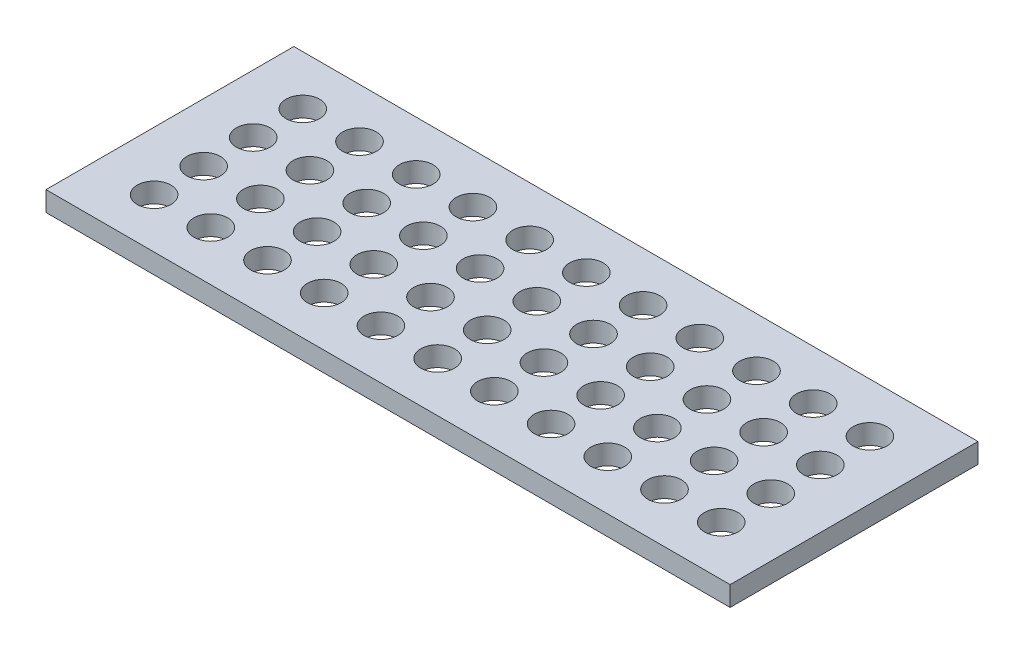
from build123d import *

# Parameters (mm, degrees)
SKETCH1_W             = 345
SKETCH1_H             = 125
SKETCH1_R             = 8.5
BOSS_EXTRUDE1_DEPTH   = 10
SKETCH1_3_R           = 8.5
CUT_EXTRUDE1_DEPTH    = 184.74574825
CRVPATTERN1_OUTLINE_R = 8.5
CRVPATTERN1_DEPTH     = 10


# Read off the part's stored shape, not the designer's step: CrvPattern1
with BuildPart() as part:
    # Sketch1 → Boss-Extrude1 (new body)
    # profile 1 of 2: a face of its own
    with BuildSketch(Plane(origin=(0, 0, 0), x_dir=(1, 0, 0), z_dir=(0, 1, 0))):
        Rectangle(SKETCH1_W, SKETCH1_H)
        with Locations((-143, 37.5)):
            Circle(SKETCH1_R, mode=Mode.SUBTRACT)
    # profile 2 of 2: a face of its own
    with BuildSketch(Plane(origin=(0, 0, 0), x_dir=(1, 0, 0), z_dir=(0, 1, 0))):
        with Locations((-143, 37.5)):
            Circle(SKETCH1_R)
    extrude(amount=BOSS_EXTRUDE1_DEPTH)

    # Sketch1<3> → Cut-Extrude1 (cut, through all)
    with BuildSketch(Plane(origin=(0, 0, 0), x_dir=(1, 0, 0), z_dir=(0, 1, 0))):
        with Locations(Location((-143, 37.5, 0), (0, 0, 270))):
            Circle(SKETCH1_3_R)
    extrude(amount=CUT_EXTRUDE1_DEPTH, mode=Mode.SUBTRACT)

    # CrvPattern1 outline → CrvPattern1 (cut)
    with BuildSketch(Plane(origin=(0, 0, 0), x_dir=(1, 0, 0), z_dir=(0, 1, 0))):
        with Locations((-143, 12.5)):
            Circle(CRVPATTERN1_OUTLINE_R)
        with Locations((143, 12.5)):
            Circle(CRVPATTERN1_OUTLINE_R)
        with Locations((143, 37.5)):
            Circle(CRVPATTERN1_OUTLINE_R)
        with Locations((114.4, -37.5)):
            Circle(CRVPATTERN1_OUTLINE_R)
        with Locations((114.4, -12.5)):
            Circle(CRVPATTERN1_OUTLINE_R)
        with Locations((114.4, 12.5)):
            Circle(CRVPATTERN1_OUTLINE_R)
        with Locations((114.4, 37.5)):
            Circle(CRVPATTERN1_OUTLINE_R)
        with Locations((85.8, -37.5)):
            Circle(CRVPATTERN1_OUTLINE_R)
        with Locations((85.8, -12.5)):
            Circle(CRVPATTERN1_OUTLINE_R)
        with Locations((143, -12.5)):
            Circle(CRVPATTERN1_OUTLINE_R)
        with Locations((143, -37.5)):
            Circle(CRVPATTERN1_OUTLINE_R)
        with Locations((-85.8, -12.5)):
            Circle(CRVPATTERN1_OUTLINE_R)
        with Locations((-85.8, -37.5)):
            Circle(CRVPATTERN1_OUTLINE_R)
        with Locations((-57.2, 37.5)):
            Circle(CRVPATTERN1_OUTLINE_R)
        with Locations((-57.2, 12.5)):
            Circle(CRVPATTERN1_OUTLINE_R)
        with Locations((-57.2, -12.5)):
            Circle(CRVPATTERN1_OUTLINE_R)
        with Locations((-57.2, -37.5)):
            Circle(CRVPATTERN1_OUTLINE_R)
        with Locations((-28.6, 37.5)):
            Circle(CRVPATTERN1_OUTLINE_R)
        with Locations((-28.6, 12.5)):
            Circle(CRVPATTERN1_OUTLINE_R)
        with Locations((-143, -12.5)):
            Circle(CRVPATTERN1_OUTLINE_R)
        with Locations((-143, -37.5)):
            Circle(CRVPATTERN1_OUTLINE_R)
        with Locations((-114.4, 37.5)):
            Circle(CRVPATTERN1_OUTLINE_R)
        with Locations((-114.4, 12.5)):
            Circle(CRVPATTERN1_OUTLINE_R)
        with Locations((-114.4, -12.5)):
            Circle(CRVPATTERN1_OUTLINE_R)
        with Locations((-114.4, -37.5)):
            Circle(CRVPATTERN1_OUTLINE_R)
        with Locations((-85.8, 37.5)):
            Circle(CRVPATTERN1_OUTLINE_R)
        with Locations((-85.8, 12.5)):
            Circle(CRVPATTERN1_OUTLINE_R)
        with Locations((28.6, -12.5)):
            Circle(CRVPATTERN1_OUTLINE_R)
        with Locations((28.6, -37.5)):
            Circle(CRVPATTERN1_OUTLINE_R)
        with Locations((57.2, 37.5)):
            Circle(CRVPATTERN1_OUTLINE_R)
        with Locations((57.2, 12.5)):
            Circle(CRVPATTERN1_OUTLINE_R)
        with Locations((57.2, -12.5)):
            Circle(CRVPATTERN1_OUTLINE_R)
        with Locations((57.2, -37.5)):
            Circle(CRVPATTERN1_OUTLINE_R)
        with Locations((85.8, 37.5)):
            Circle(CRVPATTERN1_OUTLINE_R)
        with Locations((85.8, 12.5)):
            Circle(CRVPATTERN1_OUTLINE_R)
        with Locations((-28.6, -12.5)):
            Circle(CRVPATTERN1_OUTLINE_R)
        with Locations((-28.6, -37.5)):
            Circle(CRVPATTERN1_OUTLINE_R)
        with Locations((0, 37.5)):
            Circle(CRVPATTERN1_OUTLINE_R)
        with Locations((0, 12.5)):
            Circle(CRVPATTERN1_OUTLINE_R)
        with Locations((0, -12.5)):
            Circle(CRVPATTERN1_OUTLINE_R)
        with Locations((0, -37.5)):
            Circle(CRVPATTERN1_OUTLINE_R)
        with Locations((28.6, 37.5)):
            Circle(CRVPATTERN1_OUTLINE_R)
        with Locations((28.6, 12.5)):
            Circle(CRVPATTERN1_OUTLINE_R)
    extrude(amount=CRVPATTERN1_DEPTH, mode=Mode.SUBTRACT)


solid = part.part
